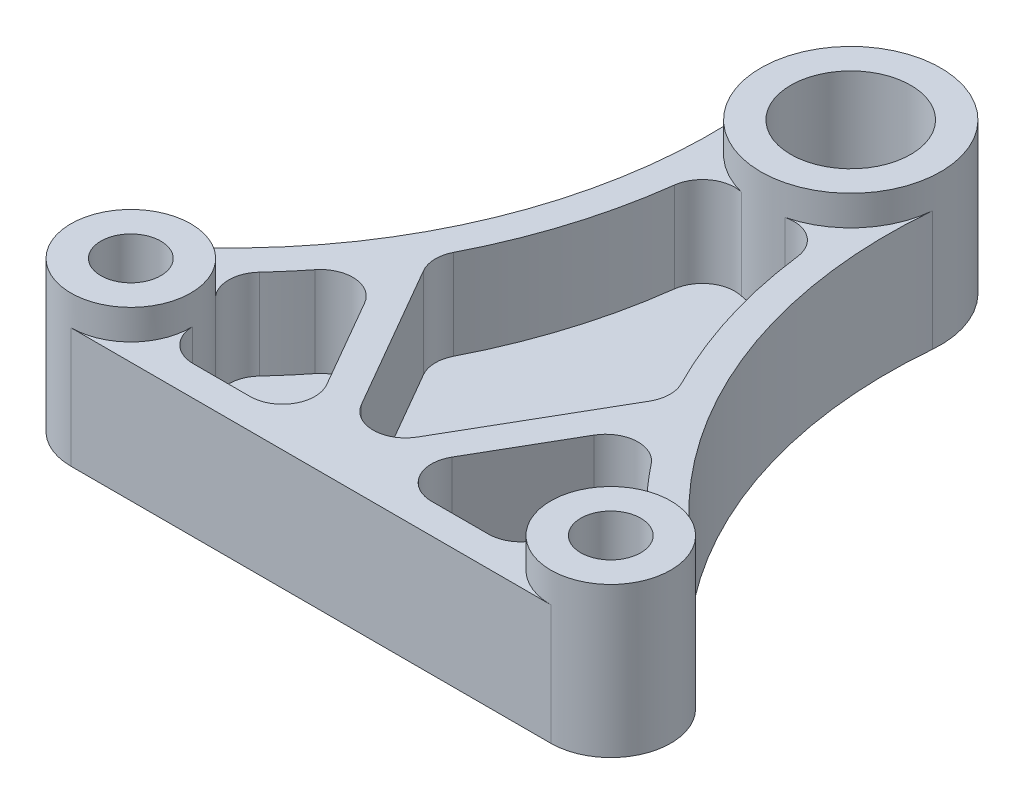
from build123d import *

# Parameters (mm, degrees)
BOSS_EXTRUDE1_DEPTH = 12.7
OUTSIDE_CIRLCES_R   = 9.525
OUTSIDE_CIRLCES_R_2 = 6.35
BOSS_EXTRUDE2_DEPTH = 15.875
SKETCH2_R           = 6.35
SKETCH2_R_2         = 3.175
CUT_EXTRUDE2_DEPTH  = 68.277043819
SHELL1_START        = 3.175
SHELL1_DEPTH        = 9.525
RIB1_START          = -9.525
RIB1_DEPTH          = 9.525
FILLET1_R           = 3.429


# Read off the part's stored shape, not the designer's step: Shell1, Rib1
with BuildPart() as part:
    # Sketch1 → Boss-Extrude1 (new body)
    with BuildSketch(Plane(origin=(0, 0, 0), x_dir=(1, 0, 0), z_dir=(0, 1, 0))):
        with BuildLine():
            Line((-25.4, -57.15), (25.4, -57.15))
            ThreePointArc((25.4, -57.15), (31.415385717, -52.834117665), (29.253859008, -45.753192024))
            ThreePointArc((29.253859008, -45.753192024), (13.590190704, -25.845719106), (9.487062801, -0.849272876))
            ThreePointArc((9.487062801, -0.849272876), (0, 9.525), (-9.487062801, -0.849272876))
            ThreePointArc((-9.487062801, -0.849272876), (-13.590190704, -25.845719106), (-29.253859008, -45.753192024))
            ThreePointArc((-29.253859008, -45.753192024), (-31.415385717, -52.834117665), (-25.4, -57.15))
        make_face()
    extrude(amount=BOSS_EXTRUDE1_DEPTH)

    # Outside Cirlces → Boss-Extrude2 (add)
    with BuildSketch(Plane(origin=(0, 0, 0), x_dir=(1, 0, 0), z_dir=(0, 1, 0))):
        with Locations(Location((0, 0, 0), (0, 0, 354.884571445))):
            Circle(OUTSIDE_CIRLCES_R)
        with Locations(Location((25.4, -50.8, 0), (0, 0, 270))):
            Circle(OUTSIDE_CIRLCES_R_2)
        with Locations(Location((-25.4, -50.8, 0), (0, 0, 90))):
            Circle(OUTSIDE_CIRLCES_R_2)
    extrude(amount=BOSS_EXTRUDE2_DEPTH)

    # Sketch2 → Cut-Extrude2 (cut, through all)
    with BuildSketch(Plane(origin=(0, 0, 0), x_dir=(1, 0, 0), z_dir=(0, 1, 0))):
        with Locations(Location((0, 0, 0), (0, 0, 270))):
            Circle(SKETCH2_R)
        with Locations(Location((-25.4, -50.8, 0), (0, 0, 270))):
            Circle(SKETCH2_R_2)
        with Locations(Location((25.4, -50.8, 0), (0, 0, 270))):
            Circle(SKETCH2_R_2)
    extrude(amount=CUT_EXTRUDE2_DEPTH, mode=Mode.SUBTRACT)

    # Shell1 outline → Shell1 (cut)
    with BuildSketch(Plane(origin=(0, 0, 0), x_dir=(1, 0, 0), z_dir=(0, 1, 0)).offset(SHELL1_START)):
        with BuildLine():
            ThreePointArc((-23.245193613, -44.826783996), (-19.436053982, -48.61966794), (-19.900738686, -53.975))
            Line((-19.900738686, -53.975), (19.900738686, -53.975))
            ThreePointArc((19.900738686, -53.975), (19.436053982, -48.61966794), (23.245193613, -44.826783996))
            ThreePointArc((23.245193613, -44.826783996), (10.964919098, -27.751584466), (6.1431994, -7.279198179))
            ThreePointArc((6.1431994, -7.279198179), (0, -9.525), (-6.1431994, -7.279198179))
            ThreePointArc((-6.1431994, -7.279198179), (-10.964919098, -27.751584466), (-23.245193613, -44.826783996))
        make_face()
    extrude(amount=SHELL1_DEPTH, mode=Mode.SUBTRACT)

    # Rib1 outline → Rib1 (add)
    with BuildSketch(Plane(origin=(0, 12.7, 0), x_dir=(1, 0, 0), z_dir=(0, 1, 0)).offset(RIB1_START)):
        with BuildLine():
            Line((12.912461206, -31.609961141), (0, -53.975))
            Line((0, -53.975), (3.666174209, -53.975))
            Line((3.666174209, -53.975), (14.782281631, -34.721337162))
            ThreePointArc((14.782281631, -34.721337162), (13.82120772, -33.181372554), (12.912461206, -31.609961141))
        make_face()
        with BuildLine():
            Line((0, -53.975), (-12.912461206, -31.609961141))
            ThreePointArc((-12.912461206, -31.609961141), (-13.82120772, -33.181372554), (-14.782281631, -34.721337162))
            Line((-14.782281631, -34.721337162), (-3.666174209, -53.975))
            Line((-3.666174209, -53.975), (0, -53.975))
        make_face()
    extrude(amount=RIB1_DEPTH)

    # Fillet1
    fillet1_edges = [part.edges().sort_by_distance(p)[0] for p in [
        (-12.912461206, 7.9375, 31.609961141),
        (-3.666174209, 7.9375, 53.975),
        (-14.782281631, 7.9375, 34.721337162),
        (14.782281631, 7.9375, 34.721337162),
        (3.666174209, 7.9375, 53.975),
        (0, 7.9375, 53.975),
        (12.912461206, 7.9375, 31.609961141),
        (-6.1431994, 7.9375, 7.279198179),
        (-19.900738686, 7.9375, 53.975),
        (23.245193613, 7.9375, 44.826783996),
        (6.1431994, 7.9375, 7.279198179),
        (-23.245193613, 7.9375, 44.826783996),
        (19.900738686, 7.9375, 53.975),
    ]]
    fillet(fillet1_edges, radius=FILLET1_R)


solid = part.part
